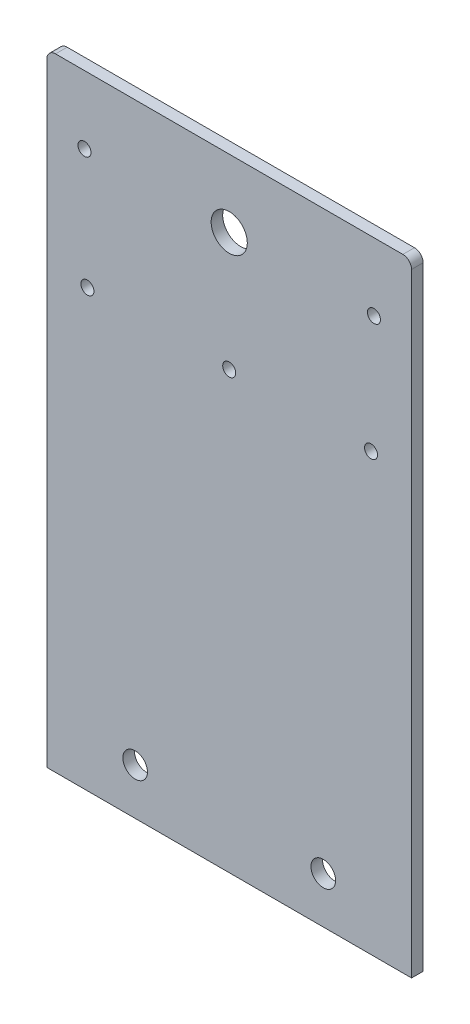
from build123d import *

# Parameters (mm, degrees)
MODEL_W               = 126
MODEL_H               = 215
MODEL_R               = 4.5
MODEL_R_2             = 6.25
MODEL_R_3             = 2.25
TABAN_FLAN_1_DEPTH    = 4
IZIM1_W               = 106.122730642
IZIM1_H               = 29.615645761
SEKME1_DEPTH          = 4
IZIM4_R               = 4.25
KES_EKSTR_ZYON1_DEPTH = 10
RADYUS1_R             = 3


# Sheet-metal steps are written as plain solids
with BuildPart() as part:
    # Model → Taban-Flanş1 (new body)
    with BuildSketch(Plane.XY):
        with Locations((2286.221333619, 1807.000391939)):
            Rectangle(MODEL_W, MODEL_H)
        with Locations((2253.766329036, 1716.390896724)):
            Circle(MODEL_R, mode=Mode.SUBTRACT)
        with Locations((2318.766329036, 1716.390896724)):
            Circle(MODEL_R, mode=Mode.SUBTRACT)
        with Locations((2286.221329024, 1891.076796715)):
            Circle(MODEL_R_2, mode=Mode.SUBTRACT)
        with Locations((2236.221317757, 1891.076801538)):
            Circle(MODEL_R_3, mode=Mode.SUBTRACT)
        with Locations((2336.221317757, 1891.076801538)):
            Circle(MODEL_R_3, mode=Mode.SUBTRACT)
        with Locations((2237.221333619, 1850.077091939)):
            Circle(MODEL_R_3, mode=Mode.SUBTRACT)
        with Locations((2286.221333601, 1850.077091925)):
            Circle(MODEL_R_3, mode=Mode.SUBTRACT)
        with Locations((2335.22132399, 1850.077101041)):
            Circle(MODEL_R_3, mode=Mode.SUBTRACT)
    extrude(amount=-TABAN_FLAN_1_DEPTH)

    # Çizim1 → Sekme1 (add)
    with BuildSketch(Plane.XY):
        with Locations((2283.753363139, 1720.312928828)):
            Rectangle(IZIM1_W, IZIM1_H)
    extrude(amount=-SEKME1_DEPTH)

    # Çizim4 → Kes-Ekstrüzyon1 (cut)
    with BuildSketch(Plane.XY):
        with Locations((2253.721333619, 1715.500391939)):
            Circle(IZIM4_R)
        with Locations((2318.721333619, 1715.500391939)):
            Circle(IZIM4_R)
    extrude(amount=-KES_EKSTR_ZYON1_DEPTH, mode=Mode.SUBTRACT)

    # Radyus1
    radyus1_edges = [part.edges().sort_by_distance(p)[0] for p in [
        (2223.221333619, 1914.500391939, -2),
        (2349.221333619, 1914.500391939, -2),
    ]]
    fillet(radyus1_edges, radius=RADYUS1_R)


solid = part.part
